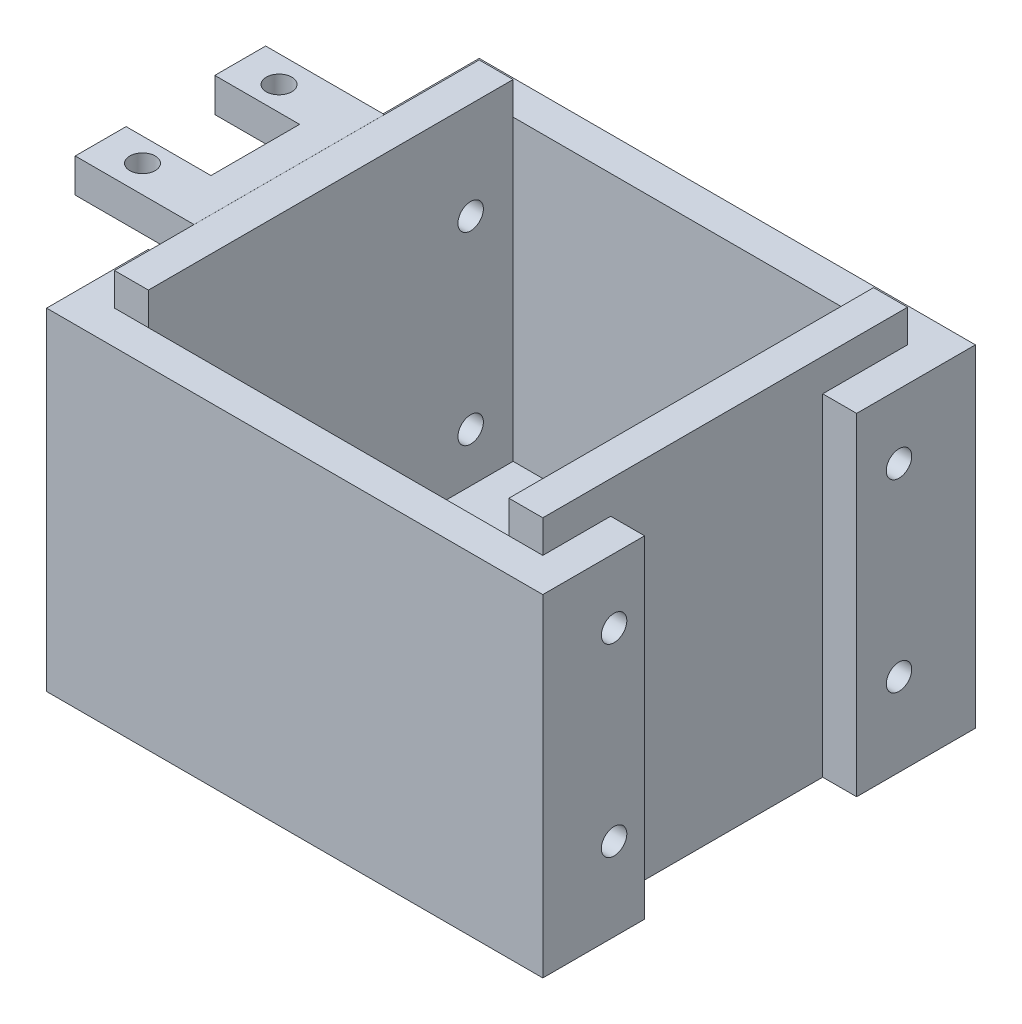
from build123d import *

# Parameters (mm, degrees)
BOSS_EXTRUDE1_DEPTH      = 43
SKETCH4_W                = 50.5
SKETCH4_H                = 39.147537046
BOSS_EXTRUDE2_DEPTH      = 4
SKETCH5_W                = 50.5
SKETCH5_H                = 39.147537046
BOSS_EXTRUDE3_DEPTH      = 4
BOSS_EXTRUDE4_DEPTH      = 17.5
BOSS_EXTRUDE4_DEPTH_BACK = 16
BOSS_EXTRUDE5_START      = 17.5
SKETCH3_3_W              = 10
SKETCH3_3_H              = 6
SKETCH3_3_R              = 1.5
BOSS_EXTRUDE5_DEPTH      = 4
BOSS_EXTRUDE5_2_DEPTH    = 4
BOSS_EXTRUDE6_START      = 17.5
BOSS_EXTRUDE6_DEPTH      = 4
BOSS_EXTRUDE7_DEPTH      = 4
BOSS_EXTRUDE7_DEPTH_BACK = 10
SKETCH5_3_W              = 4
SKETCH5_3_H              = 39.147537046
BOSS_EXTRUDE8_DEPTH      = 4
BOSS_EXTRUDE8_DEPTH_BACK = 8
SKETCH8_R                = 1.5
CUT_EXTRUDE1_DEPTH       = 79.060873682
SKETCH11_R               = 1.5
CUT_EXTRUDE2_DEPTH       = 79.060873682


with BuildPart() as part:
    # Sketch1 → Boss-Extrude1 (new body)
    with BuildSketch(Plane.XY):
        Polygon((-21.25, -17.493697991), (-21.25, 21.493697991), (-25.25, 21.493697991), (-25.25, -21.493697991), (25.25, -21.493697991), (25.25, 21.493697991), (21.25, 21.493697991), (21.25, -17.493697991), align=None)
    extrude(amount=BOSS_EXTRUDE1_DEPTH)

    # Sketch4 → Boss-Extrude2 (add)
    with BuildSketch(Plane.XY.offset(43)):
        with Locations((0, -1.919929468)):
            Rectangle(SKETCH4_W, SKETCH4_H)
    extrude(amount=BOSS_EXTRUDE2_DEPTH)

    # Sketch5 → Boss-Extrude3 (add)
    with BuildSketch(Plane(origin=(0, 0, 0), x_dir=(-1, 0, 0), z_dir=(0, 0, -1))):
        with Locations((0, -1.919929468)):
            Rectangle(SKETCH5_W, SKETCH5_H)
    extrude(amount=BOSS_EXTRUDE3_DEPTH)


with BuildPart() as boss_extrude4_tool:
    # Sketch3 → Boss-Extrude4 (new, two sides: drawn at the far end of the back side and taken through both)
    with BuildSketch(Plane(origin=(0, 0, 0), x_dir=(1, 0, 0), z_dir=(0, 1, 0)).offset(-BOSS_EXTRUDE4_DEPTH_BACK)):
        Polygon((-29.250003781, -33.625807881), (-25.250003781, -33.625807881), (-25.250003781, -11.171909281), (-29.250003781, -11.171909281), (-29.250003781, -17.171909281), (-29.250003781, -27.625807881), align=None)
    extrude(amount=BOSS_EXTRUDE4_DEPTH + BOSS_EXTRUDE4_DEPTH_BACK)


with BuildPart() as part_1:
    add(part.part)


with BuildPart() as part_2:
    # Boss-Extrude4: joined with boss_extrude4_tool
    add(part_1.part.fuse(boss_extrude4_tool.part, tol=0.00001))


with BuildPart() as body_2:
    # Sketch3<3> → Boss-Extrude5 (new body)
    with BuildSketch(Plane(origin=(0, 0, 0), x_dir=(1, 0, 0), z_dir=(0, 1, 0)).offset(BOSS_EXTRUDE5_START)):
        with Locations((-34.250003781, -30.625807881)):
            Rectangle(SKETCH3_3_W, SKETCH3_3_H)
        with Locations(Location((-34.536906803, -30.406566851, 0), (0, 0, 270))):
            Circle(SKETCH3_3_R, mode=Mode.SUBTRACT)
    extrude(amount=BOSS_EXTRUDE5_DEPTH)


with BuildPart() as body_3:
    # Sketch3<3> → Boss-Extrude5 2 (new body)
    with BuildSketch(Plane(origin=(0, 0, 0), x_dir=(1, 0, 0), z_dir=(0, 1, 0)).offset(BOSS_EXTRUDE5_START)):
        with Locations((-34.250003781, -14.171909281)):
            Rectangle(SKETCH3_3_W, SKETCH3_3_H)
        with Locations(Location((-34.536906803, -14.310361699, 0), (0, 0, 270))):
            Circle(SKETCH3_3_R, mode=Mode.SUBTRACT)
    extrude(amount=BOSS_EXTRUDE5_2_DEPTH)


with BuildPart() as boss_extrude6_tool:
    # Sketch3<4> → Boss-Extrude6 (new body)
    with BuildSketch(Plane(origin=(0, 0, 0), x_dir=(1, 0, 0), z_dir=(0, 1, 0)).offset(BOSS_EXTRUDE6_START)):
        Polygon((-29.250003781, -33.625807881), (-25.250003781, -33.625807881), (-25.250003781, -11.171909281), (-29.250003781, -11.171909281), (-29.250003781, -17.171909281), (-29.250003781, -27.625807881), align=None)
    extrude(amount=BOSS_EXTRUDE6_DEPTH)


with BuildPart() as part_3:
    add(part_2.part)


with BuildPart() as part_4:
    # Boss-Extrude6: joined with boss_extrude6_tool
    add(part_3.part.fuse(boss_extrude6_tool.part, body_2.part, body_3.part, tol=0.00001))

    # Sketch5<3> → Boss-Extrude7 (add, two sides: drawn at the far end of the back side and taken through both)
    with BuildSketch(Plane(origin=(0, 0, 0), x_dir=(-1, 0, 0), z_dir=(0, 0, -1)).offset(-BOSS_EXTRUDE7_DEPTH_BACK)):
        with Locations((-27.25, -1.919929468)):
            Rectangle(SKETCH5_3_W, SKETCH5_3_H)
        with Locations((27.25, -1.919929468)):
            Rectangle(SKETCH5_3_W, SKETCH5_3_H)
    extrude(amount=BOSS_EXTRUDE7_DEPTH + BOSS_EXTRUDE7_DEPTH_BACK)

    # Sketch4<3> → Boss-Extrude8 (add, two sides: drawn at the far end of the back side and taken through both)
    with BuildSketch(Plane.XY.offset(43).offset(-BOSS_EXTRUDE8_DEPTH_BACK)):
        Polygon((29.25, 17.653839055), (25.25, 17.653839055), (25.25, -21.493697991), (29.25, -21.493697991), (29.25, -17.493697991), (29.25, 13.653839055), align=None)
        Polygon((-25.25, -21.493697991), (-25.25, 17.653839055), (-29.25, 17.653839055), (-29.25, 13.653839055), (-29.25, -17.493697991), (-29.25, -21.493697991), align=None)
    extrude(amount=BOSS_EXTRUDE8_DEPTH + BOSS_EXTRUDE8_DEPTH_BACK)

    # Sketch8 → Cut-Extrude1 (cut, through all)
    with BuildSketch(Plane.ZY.offset(29.25)):
        with Locations((5.005736184, 10.04444872)):
            Circle(SKETCH8_R)
        with Locations((5.005736184, -11.726773354)):
            Circle(SKETCH8_R)
    extrude(amount=-CUT_EXTRUDE1_DEPTH, mode=Mode.SUBTRACT)

    # Sketch11 → Cut-Extrude2 (cut, through all)
    with BuildSketch(Plane.ZY.offset(29.25)):
        with Locations((38.59734476, -11.726773354)):
            Circle(SKETCH11_R)
        with Locations((38.59734476, 10.04444872)):
            Circle(SKETCH11_R)
    extrude(amount=-CUT_EXTRUDE2_DEPTH, mode=Mode.SUBTRACT)


solid = part_4.part
